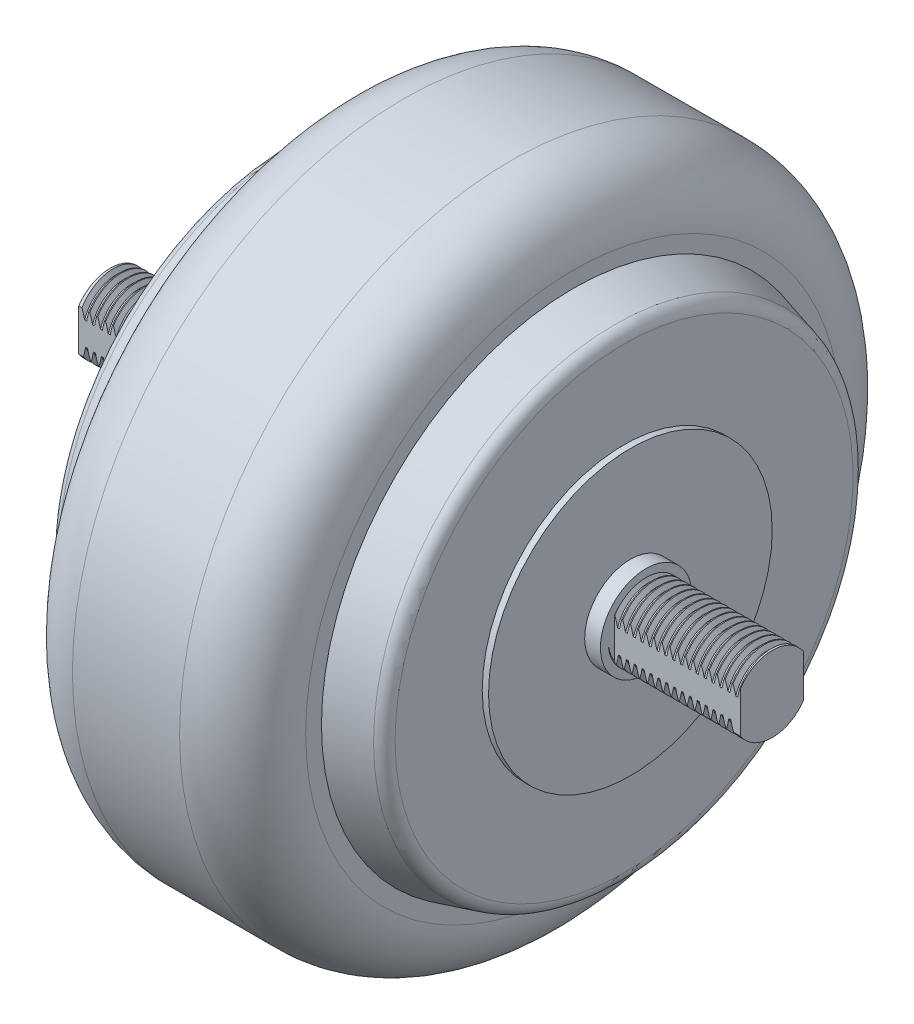
from build123d import *

# Parameters (mm, degrees)
FILLET_1_R          = 10
FILLET_2_R          = 2
THREAD_1_PITCH      = 1.25
THREAD_2_PITCH      = 1.25
CUT_EXTRUDE_1_REACH = 130.598
CUT_EXTRUDE_2_DEPTH = 20


with BuildPart() as part:
    # Sketch 1 → 旋转2 (revolve)
    with BuildSketch(Plane.XY, mode=Mode.PRIVATE) as revolve_2_sk:
        Polygon((-18.5, 52.5), (18.5, 52.5), (18.5, 40), (26.5, 37.856406461), (26.5, 22.5), (27.5, 22.5), (27.5, 7.25), (30, 7.25), (30, 6), (50, 6), (50, 0), (-55, 0), (-55, 6), (-30, 6), (-30, 7.25), (-27.5, 7.25), (-27.5, 22.5), (-26.5, 22.5), (-26.5, 37.856406461), (-18.5, 40), align=None)
    revolve(revolve_2_sk.sketch.rotate(Axis((-145.943925234, 0, 0), (1, 0, 0)), 90), axis=Axis((-145.943925234, 0, 0), (1, 0, 0)))

    # 圆角1
    fillet_1_edges = [part.edges().sort_by_distance(p)[0] for p in [
        (18.5, 0, -52.5),
        (-18.5, 0, -52.5),
    ]]
    fillet(fillet_1_edges, radius=FILLET_1_R)

    # 圆角2
    fillet_2_edges = [part.edges().sort_by_distance(p)[0] for p in [
        (-26.5, 0, -37.856406461),
        (26.5, 0, -37.856406461),
    ]]
    fillet(fillet_2_edges, radius=FILLET_2_R)

    # 螺纹线1: the profile of Sketch 1 2 profile screwed along a right-hand helix of 12 turns, 8 arcs to a turn; built about Z, then put on its axis
    thread_1_z = Axis((0, 0, 0), (0, 0, 1))
    thread_1_corners = [(6.0003, 0, -0.000173205), (6.0003, 0, 1.093923202), (5.323417656, 0, 0.703124998), (5.323417656, 0, 0.390624998)]
    with BuildLine(mode=Mode.PRIVATE) as thread_1_profile:
        Line(thread_1_corners[0], thread_1_corners[1])
        Line(thread_1_corners[1], thread_1_corners[2])
        Line(thread_1_corners[2], thread_1_corners[3])
        Line(thread_1_corners[3], thread_1_corners[0])
    thread_1_cap = Face(thread_1_profile.wire())
    thread_1_turn_angles = [0, 22.5, 45, 67.5, 90, 112.5, 135, 157.5, 180, 202.5, 225, 247.5, 270, 292.5, 315, 337.5, 360]
    thread_1_turn_weights = [1, 0.9238795325112867, 1, 0.9238795325112867, 1, 0.9238795325112867, 1, 0.9238795325112867, 1, 0.9238795325112867, 1, 0.9238795325112867, 1, 0.9238795325112867, 1, 0.9238795325112867, 1]
    thread_1_turn_rails = [Edge.make_bspline([Vector(p[0], p[1], 0).rotate(thread_1_z, thread_1_turn_angles[k]) / thread_1_turn_weights[k] + Vector(0, 0, p[2] + THREAD_1_PITCH * thread_1_turn_angles[k] / 360) for k in range(17)], [0, 0, 0, 1, 1, 2, 2, 3, 3, 4, 4, 5, 5, 6, 6, 7, 7, 8, 8, 8], 2, thread_1_turn_weights) for p in thread_1_corners]
    thread_1_turn_sides = [Face.make_surface_from_curves(thread_1_turn_rails[p[0]], thread_1_turn_rails[p[1]]) for p in [(0, 1), (1, 2), (2, 3), (3, 0)]]
    thread_1 = Plane(origin=(-55, 0, 0), x_dir=(0, 0, -1), z_dir=(1, 0, 0)) * Solid(Shell([*[p.moved(Location((0, 0, THREAD_1_PITCH * i))) for i in range(12) for p in thread_1_turn_sides], thread_1_cap, thread_1_cap.rotate(thread_1_z, 4320).moved(Location((0, 0, THREAD_1_PITCH * 4320 / 360)))]))
    add(thread_1, mode=Mode.SUBTRACT)

    # 螺纹线2: the profile of 螺纹线轮廓2 profile screwed along a right-hand helix of 16 turns, 8 arcs to a turn; built about Z, then put on its axis
    thread_2_z = Axis((0, 0, 0), (0, 0, 1))
    thread_2_corners = [(6.0003, 0, -0.000173205), (6.0003, 0, 1.093923202), (5.323417656, 0, 0.703124998), (5.323417656, 0, 0.390624998)]
    with BuildLine(mode=Mode.PRIVATE) as thread_2_profile:
        Line(thread_2_corners[0], thread_2_corners[1])
        Line(thread_2_corners[1], thread_2_corners[2])
        Line(thread_2_corners[2], thread_2_corners[3])
        Line(thread_2_corners[3], thread_2_corners[0])
    thread_2_cap = Face(thread_2_profile.wire())
    thread_2_turn_angles = [0, 22.5, 45, 67.5, 90, 112.5, 135, 157.5, 180, 202.5, 225, 247.5, 270, 292.5, 315, 337.5, 360]
    thread_2_turn_weights = [1, 0.9238795325112867, 1, 0.9238795325112867, 1, 0.9238795325112867, 1, 0.9238795325112867, 1, 0.9238795325112867, 1, 0.9238795325112867, 1, 0.9238795325112867, 1, 0.9238795325112867, 1]
    thread_2_turn_rails = [Edge.make_bspline([Vector(p[0], p[1], 0).rotate(thread_2_z, thread_2_turn_angles[k]) / thread_2_turn_weights[k] + Vector(0, 0, p[2] + THREAD_2_PITCH * thread_2_turn_angles[k] / 360) for k in range(17)], [0, 0, 0, 1, 1, 2, 2, 3, 3, 4, 4, 5, 5, 6, 6, 7, 7, 8, 8, 8], 2, thread_2_turn_weights) for p in thread_2_corners]
    thread_2_turn_sides = [Face.make_surface_from_curves(thread_2_turn_rails[p[0]], thread_2_turn_rails[p[1]]) for p in [(0, 1), (1, 2), (2, 3), (3, 0)]]
    thread_2 = Plane(origin=(50, 0, 0), x_dir=(0, 0, 1), z_dir=(-1, 0, 0)) * Solid(Shell([*[p.moved(Location((0, 0, THREAD_2_PITCH * i))) for i in range(16) for p in thread_2_turn_sides], thread_2_cap, thread_2_cap.rotate(thread_2_z, 5760).moved(Location((0, 0, THREAD_2_PITCH * 5760 / 360)))]))
    add(thread_2, mode=Mode.SUBTRACT)

    # 切除-拉伸1: up to this face of the body (flat: up to its plane)
    cut_extrude_1_end = Plane(part.part.faces().sort_by_distance((-30, 0, -6.205060967))[0])
    # 草图9 → 切除-拉伸1 (cut, up to the picked face)
    with BuildSketch(Plane.ZY.offset(55), mode=Mode.PRIVATE) as cut_extrude_1_sk1:
        with BuildLine():
            Line((-5, 3.31662479), (-5, -3.31662479))
            ThreePointArc((-5, -3.31662479), (-6, 0), (-5, 3.31662479))
        make_face()
    cut_extrude_1_tool1 = split(extrude(cut_extrude_1_sk1.sketch, amount=-CUT_EXTRUDE_1_REACH, mode=Mode.PRIVATE), bisect_by=cut_extrude_1_end, keep=Keep.BOTH, mode=Mode.PRIVATE)
    # 草图9 → 切除-拉伸1 (cut, up to the picked face)
    with BuildSketch(Plane.ZY.offset(55), mode=Mode.PRIVATE) as cut_extrude_1_sk2:
        with BuildLine():
            Line((5, 3.31662479), (5, -3.31662479))
            ThreePointArc((5, -3.31662479), (6, 0), (5, 3.31662479))
        make_face()
    cut_extrude_1_tool2 = split(extrude(cut_extrude_1_sk2.sketch, amount=-CUT_EXTRUDE_1_REACH, mode=Mode.PRIVATE), bisect_by=cut_extrude_1_end, keep=Keep.BOTH, mode=Mode.PRIVATE)
    add(cut_extrude_1_tool1.solids().sort_by(Axis((-55, 0, -5.403002), (1, 0, 0)))[0], mode=Mode.SUBTRACT)
    add(cut_extrude_1_tool2.solids().sort_by(Axis((-55, 0, 5.403002), (1, 0, 0)))[0], mode=Mode.SUBTRACT)

    # 草图10 → 切除-拉伸2 (cut)
    with BuildSketch(Plane(origin=(50, 0, -54), x_dir=(0, 0, 1), z_dir=(-1, 0, 0))):
        with BuildLine():
            Line((49, 3.31662479), (49, -3.31662479))
            ThreePointArc((49, -3.31662479), (48, 0), (49, 3.31662479))
        make_face()
        with BuildLine():
            Line((59, 3.31662479), (59, -3.31662479))
            ThreePointArc((59, -3.31662479), (60, 0), (59, 3.31662479))
        make_face()
    extrude(amount=CUT_EXTRUDE_2_DEPTH, mode=Mode.SUBTRACT)


solid = part.part
